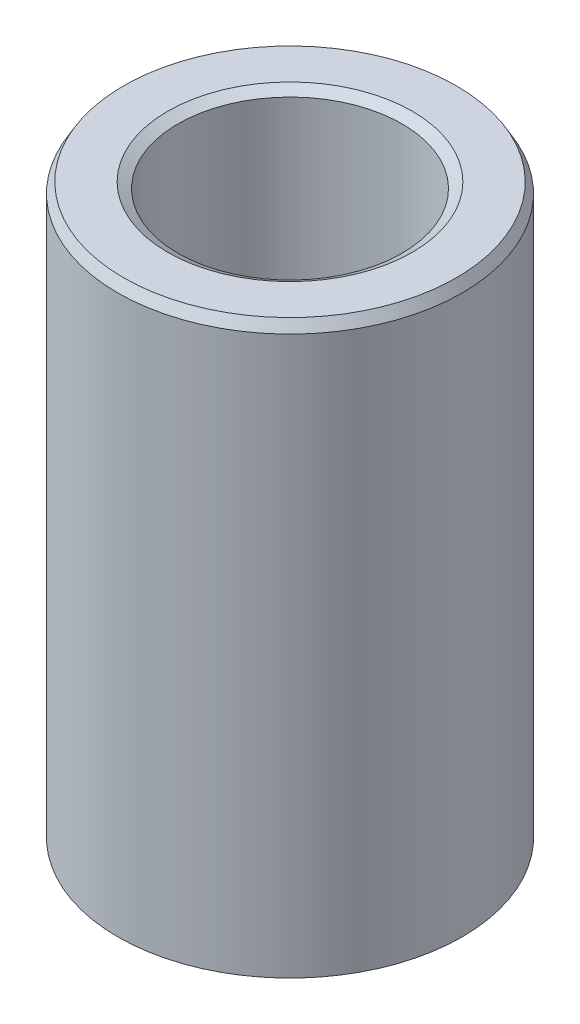
from build123d import *
from OCP.BRepFilletAPI import BRepFilletAPI_MakeChamfer

# Parameters (mm, degrees)
SKETCH1_R           = 40
BOSS_EXTRUDE1_DEPTH = 133.277725298
SKETCH2_R           = 26.039241528
CUT_EXTRUDE1_DEPTH  = 145.785883499
CHAMFER1_SIZE       = 2.361900972
CHAMFER1_SIZE2      = 1.363644162


with BuildPart() as part:
    # Sketch1 → Boss-Extrude1 (new body)
    with BuildSketch(Plane(origin=(0, 0, 0), x_dir=(1, 0, 0), z_dir=(0, 1, 0))):
        Circle(SKETCH1_R)
    extrude(amount=BOSS_EXTRUDE1_DEPTH)

    # Sketch2 → Cut-Extrude1 (cut, through all)
    with BuildSketch(Plane(origin=(0, 0, 0), x_dir=(1, 0, 0), z_dir=(0, 1, 0))):
        Circle(SKETCH2_R)
    extrude(amount=CUT_EXTRUDE1_DEPTH, mode=Mode.SUBTRACT)

    # Chamfer1: one chamfer whose edges measure the first distance from different faces: ONE call of the kernel's chamfer builder (chamfer() names one face for all edges)
    chamfer1_edges_1 = [part.edges().sort_by_distance(p)[0] for p in [
        (-26.039241528, 133.277725298, 0),
    ]]
    chamfer1_side_1 = [part.faces().sort_by_distance(p)[0] for p in [
        (-38.86862915, 133.277725298, 0),
    ]]
    chamfer1_edges_2 = [part.edges().sort_by_distance(p)[0] for p in [
        (-26.039241528, 0, 0),
    ]]
    chamfer1_side_2 = [part.faces().sort_by_distance(p)[0] for p in [
        (-26.039241528, 66.638862649, 0),
    ]]
    chamfer1_edges_3 = [part.edges().sort_by_distance(p)[0] for p in [
        (-40, 0, 0),
    ]]
    chamfer1_side_3 = [part.faces().sort_by_distance(p)[0] for p in [
        (-38.86862915, 0, 0),
    ]]
    chamfer1_edges_4 = [part.edges().sort_by_distance(p)[0] for p in [
        (-40, 133.277725298, 0),
    ]]
    chamfer1_side_4 = [part.faces().sort_by_distance(p)[0] for p in [
        (-40, 66.638862649, 0),
    ]]
    chamfer1 = BRepFilletAPI_MakeChamfer(part.part.solid().wrapped)
    for e in chamfer1_edges_1:
        chamfer1.Add(CHAMFER1_SIZE, CHAMFER1_SIZE2, e.wrapped, chamfer1_side_1[0].wrapped)  # the first distance lies on this face
    for e in chamfer1_edges_2:
        chamfer1.Add(CHAMFER1_SIZE, CHAMFER1_SIZE2, e.wrapped, chamfer1_side_2[0].wrapped)  # the first distance lies on this face
    for e in chamfer1_edges_3:
        chamfer1.Add(CHAMFER1_SIZE, CHAMFER1_SIZE2, e.wrapped, chamfer1_side_3[0].wrapped)  # the first distance lies on this face
    for e in chamfer1_edges_4:
        chamfer1.Add(CHAMFER1_SIZE, CHAMFER1_SIZE2, e.wrapped, chamfer1_side_4[0].wrapped)  # the first distance lies on this face
    add(Compound.cast(chamfer1.Shape()), mode=Mode.REPLACE)


solid = part.part
